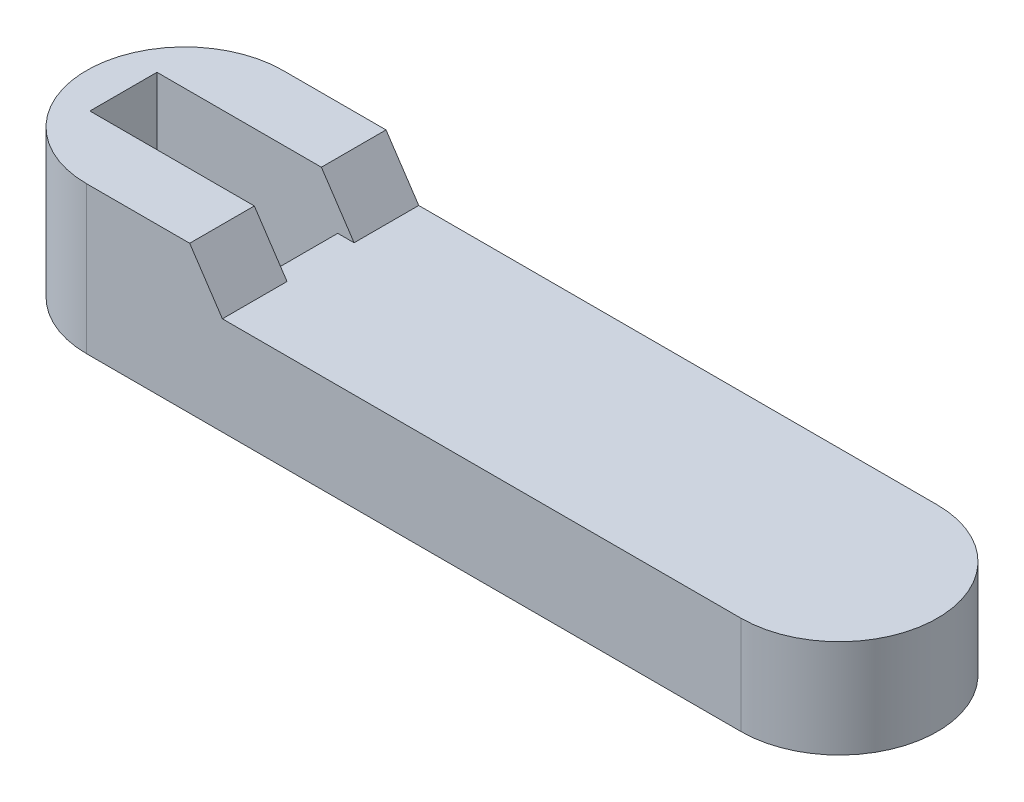
from build123d import *

# Parameters (mm, degrees)
BOSS_EXTRUDE1_DEPTH = 30
SKETCH2_R           = 7
CUT_EXTRUDE1_DEPTH  = 240.582971014
CUT_EXTRUDE2_DEPTH  = 28.5
BOSS_EXTRUDE2_DEPTH = 15
CUT_EXTRUDE3_DEPTH  = 242.919408068


with BuildPart() as part:
    # Sketch1 → Boss-Extrude1 (new body)
    with BuildSketch(Plane(origin=(0, 0, 0), x_dir=(1, 0, 0), z_dir=(0, 1, 0))):
        with BuildLine():
            Line((0, 0), (200, 0))
            ThreePointArc((200, 0), (230, 30), (200, 60))
            Line((200, 60), (0, 60))
            ThreePointArc((0, 60), (-30, 30), (0, 0))
        make_face()
    extrude(amount=BOSS_EXTRUDE1_DEPTH)

    # Sketch2 → Cut-Extrude1 (cut, through all)
    with BuildSketch(Plane(origin=(0, 30, 0), x_dir=(1, 0, 0), z_dir=(0, 1, 0))):
        with Locations((0, 30)):
            Circle(SKETCH2_R)
    extrude(amount=-CUT_EXTRUDE1_DEPTH, mode=Mode.SUBTRACT)

    # Sketch3 → Cut-Extrude2 (cut)
    with BuildSketch(Plane(origin=(0, 30, 0), x_dir=(1, 0, 0), z_dir=(0, 1, 0))):
        Polygon((-18.75, 40.25), (-18.75, 19.75), (0, 19.75), (36.5, 19.75), (36.5, 40.25), (0, 40.25), align=None)
    extrude(amount=-CUT_EXTRUDE2_DEPTH, mode=Mode.SUBTRACT)

    # Sketch4 → Boss-Extrude2 (add)
    with BuildSketch(Plane(origin=(0, 30, 0), x_dir=(1, 0, 0), z_dir=(0, 1, 0))):
        with BuildLine():
            Line((-18.75, 40.25), (41.5, 40.25))
            Line((41.5, 40.25), (41.5, 60))
            Line((41.5, 60), (0, 60))
            ThreePointArc((0, 60), (-30, 30), (0, 0))
            Line((0, 0), (41.5, 0))
            Line((41.5, 0), (41.5, 19.75))
            Line((41.5, 19.75), (-18.75, 19.75))
            Line((-18.75, 19.75), (-18.75, 40.25))
        make_face()
    extrude(amount=BOSS_EXTRUDE2_DEPTH)

    # Sketch5 → Cut-Extrude3 (cut, through all)
    with BuildSketch(Plane.XY):
        Polygon((31.5, 45), (41.5, 45), (41.5, 30), align=None)
    extrude(amount=-CUT_EXTRUDE3_DEPTH, mode=Mode.SUBTRACT)


solid = part.part
